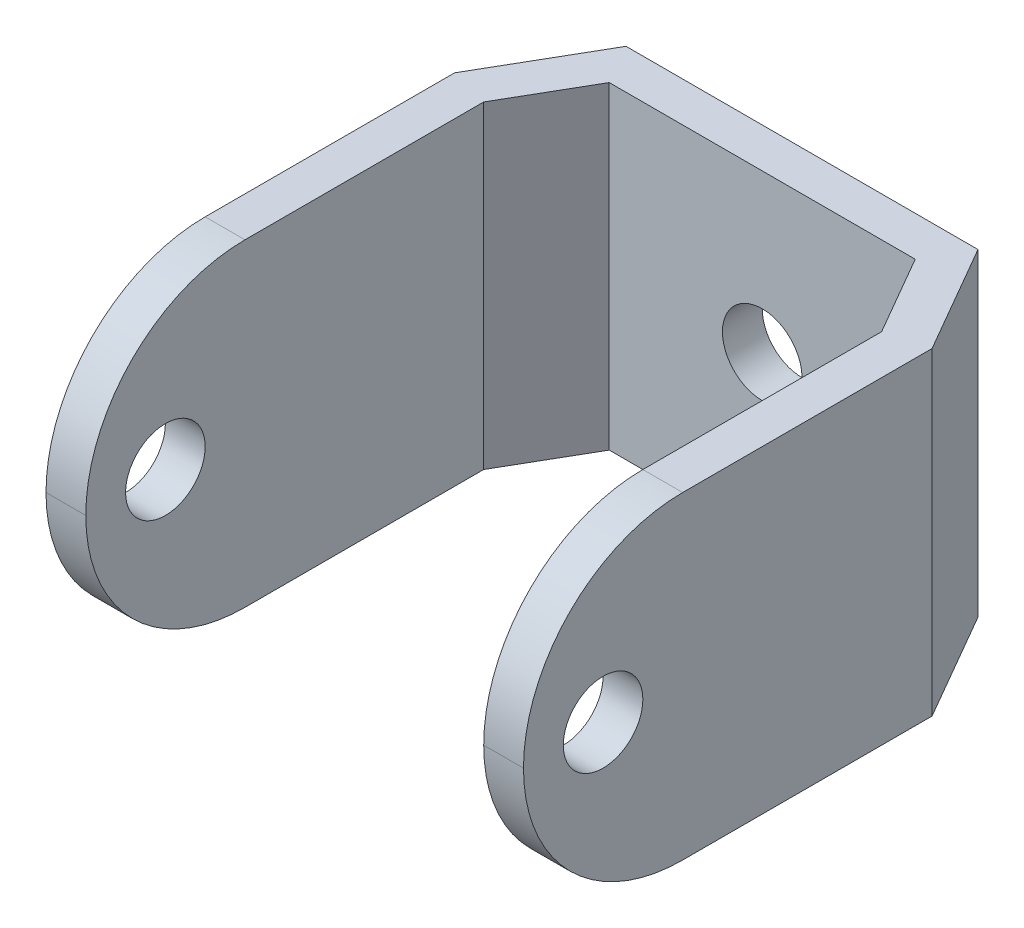
from build123d import *

# Parameters (mm, degrees)
BOSS_EXTRUDE1_DEPTH = 40
SKETCH3_R           = 5
CUT_EXTRUDE1_DEPTH  = 98.082439195
FILLET1_R           = 20
CUT_EXTRUDE2_REACH  = 84.006
SKETCH4_R           = 5


with BuildPart() as part:
    # Sketch2 → Boss-Extrude1 (new body)
    with BuildSketch(Plane(origin=(0, 0, 0), x_dir=(1, 0, 0), z_dir=(0, 1, 0))):
        Polygon((-30, 0), (-30, 51.339745962), (-22.113248654, 65), (22.113248654, 65), (30, 51.339745962), (30, 0), (25, 0), (25, 50), (19.226497308, 60), (-19.226497308, 60), (-25, 50), (-25, 0), align=None)
    extrude(amount=BOSS_EXTRUDE1_DEPTH)

    # Sketch3 → Cut-Extrude1 (cut, through all)
    with BuildSketch(Plane(origin=(30, 0, 0), x_dir=(0, 0, -1), z_dir=(1, 0, 0))):
        with Locations((10, 20)):
            Circle(SKETCH3_R)
    extrude(amount=-CUT_EXTRUDE1_DEPTH, mode=Mode.SUBTRACT)

    # Fillet1
    fillet1_edges = [part.edges().sort_by_distance(p)[0] for p in [
        (27.5, 40, 0),
        (-27.5, 40, 0),
        (-27.5, 0, 0),
        (27.5, 0, 0),
    ]]
    fillet(fillet1_edges, radius=FILLET1_R - 0.0001)  # a hair under: the kernel refuses the full size

    # Sketch4 → Cut-Extrude2 (cut, up to next)
    with BuildSketch(Plane(origin=(0, 0, -65), x_dir=(-1, 0, 0), z_dir=(0, 0, -1)), mode=Mode.PRIVATE) as cut_extrude2_sk1:
        with Locations((0, 20)):
            Circle(SKETCH4_R)
    cut_extrude2_tool1 = extrude(cut_extrude2_sk1.sketch, amount=-CUT_EXTRUDE2_REACH, mode=Mode.PRIVATE) & part.part
    add(cut_extrude2_tool1.solids().sort_by_distance((0, 20, -65))[0], mode=Mode.SUBTRACT)


solid = part.part
